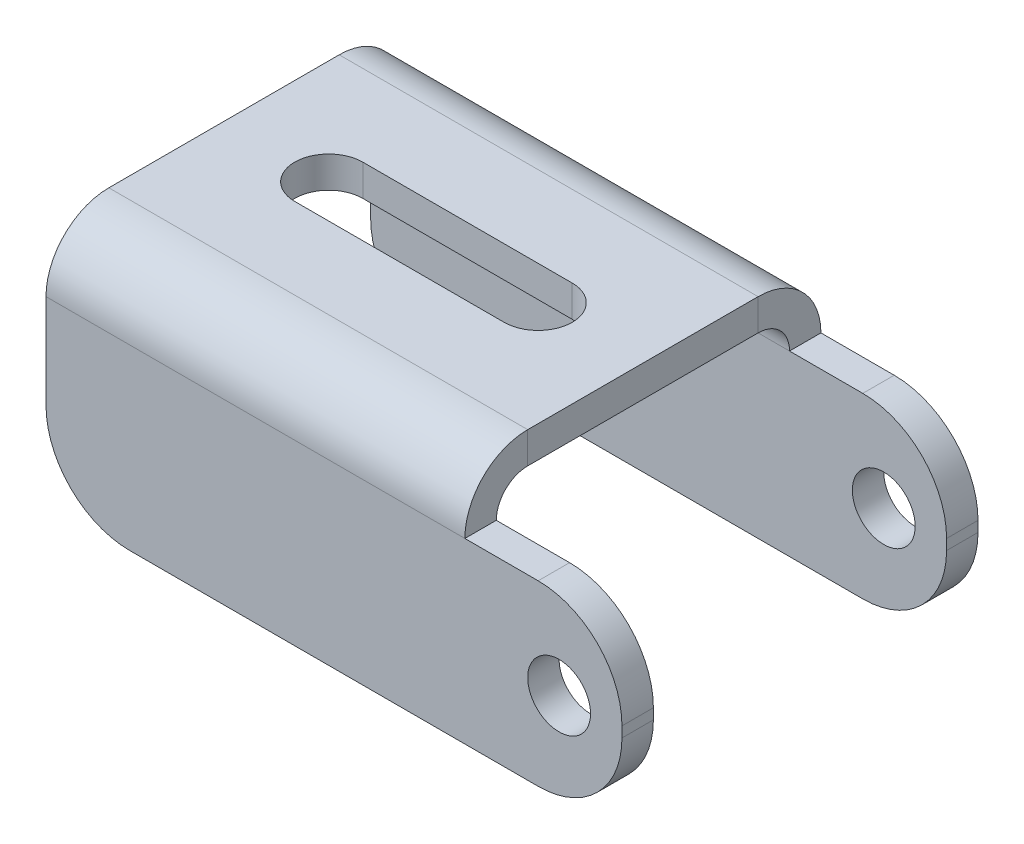
from build123d import *

# Parameters (mm, degrees)
BASE_FLANGE1_DEPTH       = 55
EXTRUDE1_START           = -23
EXTRUDE1_OUTLINE_W       = 15
EXTRUDE1_OUTLINE_H       = 36
EXTRUDE1_DEPTH           = 6
F_6_0_6_DIAMETER_HOLE1_D = 6
FILLET1_R                = 8
EXTRUDE2_DEPTH           = 61.942595941
FILLET2_R                = 8


# Read off the part's stored shape, not the designer's step: Extrude1
# Sheet-metal steps are written as plain solids
with BuildPart() as part:
    # Sketch1 → Base-Flange1 (new body)
    with BuildSketch(Plane(origin=(0, 0, 0), x_dir=(0, 0, -1), z_dir=(1, 0, 0))):
        with BuildLine():
            Line((-14, 0), (-14, 17))
            ThreePointArc((-14, 17), (-13.121320344, 19.121320344), (-11, 20))
            Line((-11, 20), (11, 20))
            ThreePointArc((11, 20), (13.121320344, 19.121320344), (14, 17))
            Line((14, 17), (14, 0))
            Line((14, 0), (17, 0))
            Line((17, 0), (17, 17))
            ThreePointArc((17, 17), (15.242640687, 21.242640687), (11, 23))
            Line((11, 23), (-11, 23))
            ThreePointArc((-11, 23), (-15.242640687, 21.242640687), (-17, 17))
            Line((-17, 17), (-17, 0))
            Line((-17, 0), (-14, 0))
        make_face()
    extrude(amount=BASE_FLANGE1_DEPTH)

    # Extrude1 outline → Extrude1 (cut)
    with BuildSketch(Plane.XZ.offset(EXTRUDE1_START)):
        with Locations((47.5, 0)):
            Rectangle(EXTRUDE1_OUTLINE_W, EXTRUDE1_OUTLINE_H)
    extrude(amount=EXTRUDE1_DEPTH, mode=Mode.SUBTRACT)

    # Ø6.0 (6) Diameter Hole1 (through all)
    with Locations(Plane.XY.offset(17)):
        with Locations((49, 8.5)):
            Hole(F_6_0_6_DIAMETER_HOLE1_D / 2)

    # Fillet1
    fillet1_edges = [part.edges().sort_by_distance(p)[0] for p in [
        (55, 0, 15.5),
        (55, 17, -15.5),
        (55, 17, 15.5),
        (55, 0, -15.5),
    ]]
    fillet(fillet1_edges, radius=FILLET1_R)

    # Sketch11 → Extrude2 (cut, through all)
    with BuildSketch(Plane.XZ.offset(-20)):
        with BuildLine():
            Line((10, 3.25), (30, 3.25))
            ThreePointArc((30, 3.25), (33.25, 0), (30, -3.25))
            Line((30, -3.25), (10, -3.25))
            ThreePointArc((10, -3.25), (6.75, 0), (10, 3.25))
        make_face()
    extrude(amount=-EXTRUDE2_DEPTH, mode=Mode.SUBTRACT)

    # Fillet2
    fillet2_edges = [part.edges().sort_by_distance(p)[0] for p in [
        (0, 0, 15.5),
        (0, 0, -15.5),
    ]]
    fillet(fillet2_edges, radius=FILLET2_R)


solid = part.part
